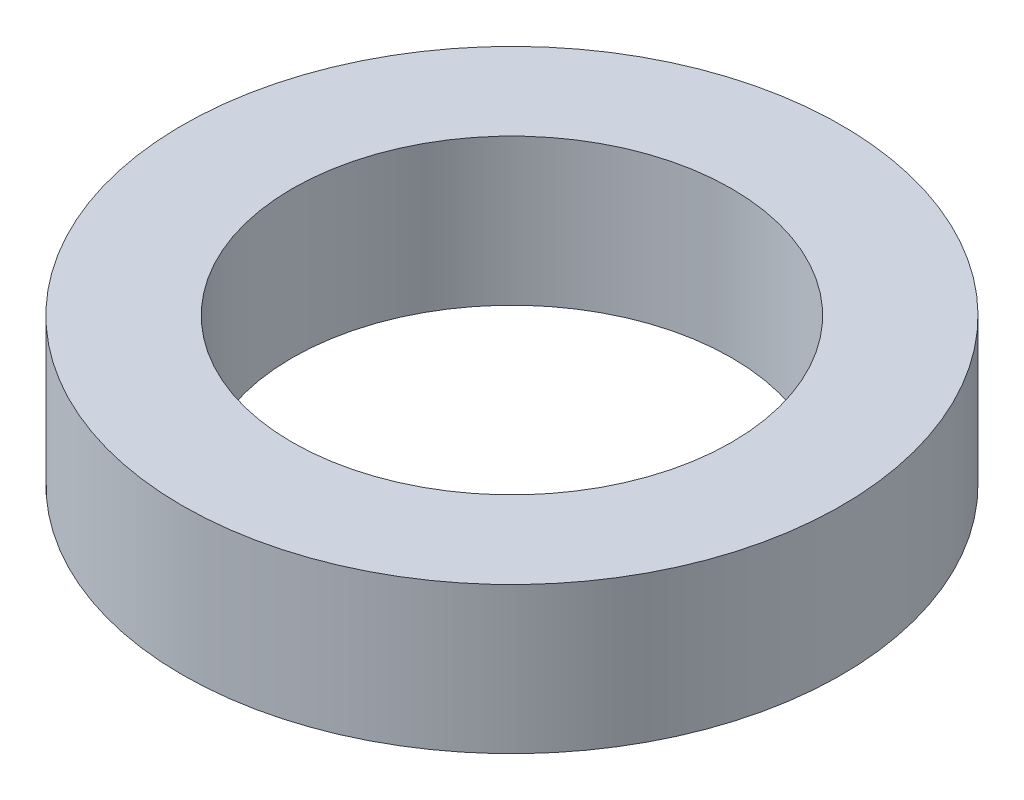
from build123d import *

# Parameters (mm, degrees)
SKETCH1_R           = 22.5
BOSS_EXTRUDE1_DEPTH = 10
SKETCH2_R           = 15
CUT_EXTRUDE1_DEPTH  = 34.35416016


with BuildPart() as part:
    # Sketch1 → Boss-Extrude1 (new body)
    with BuildSketch(Plane(origin=(0, 0, 0), x_dir=(1, 0, 0), z_dir=(0, 1, 0))):
        Circle(SKETCH1_R)
    extrude(amount=BOSS_EXTRUDE1_DEPTH)

    # Sketch2 → Cut-Extrude1 (cut, through all)
    with BuildSketch(Plane(origin=(0, 0, 0), x_dir=(1, 0, 0), z_dir=(0, 1, 0))):
        Circle(SKETCH2_R)
    extrude(amount=CUT_EXTRUDE1_DEPTH, mode=Mode.SUBTRACT)


solid = part.part
